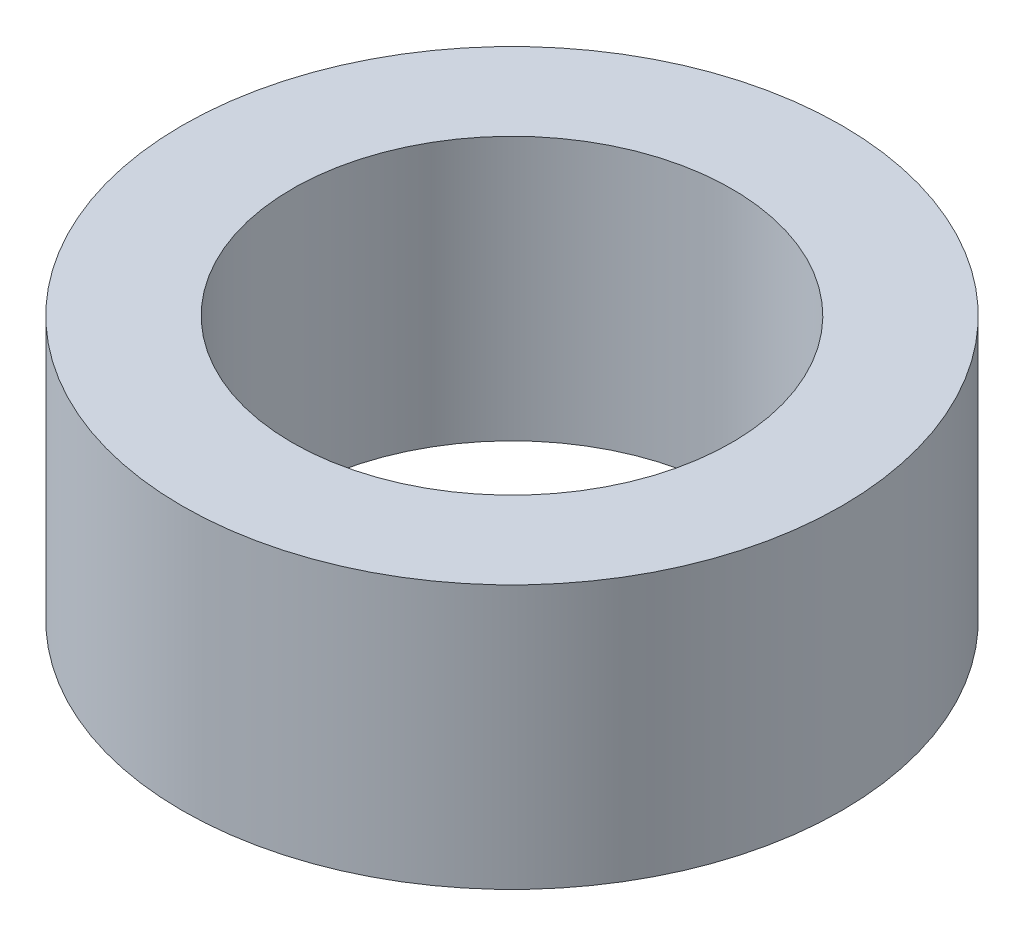
from build123d import *

# Parameters (mm, degrees)
SKETCH1_R           = 22.5
BOSS_EXTRUDE1_DEPTH = 18
SKETCH2_R           = 15
CUT_EXTRUDE1_DEPTH  = 37.558172821


with BuildPart() as part:
    # Sketch1 → Boss-Extrude1 (new body)
    with BuildSketch(Plane(origin=(0, 0, 0), x_dir=(1, 0, 0), z_dir=(0, 1, 0))):
        Circle(SKETCH1_R)
    extrude(amount=BOSS_EXTRUDE1_DEPTH)

    # Sketch2 → Cut-Extrude1 (cut, through all)
    with BuildSketch(Plane(origin=(0, 0, 0), x_dir=(1, 0, 0), z_dir=(0, 1, 0))):
        Circle(SKETCH2_R)
    extrude(amount=CUT_EXTRUDE1_DEPTH, mode=Mode.SUBTRACT)


solid = part.part
